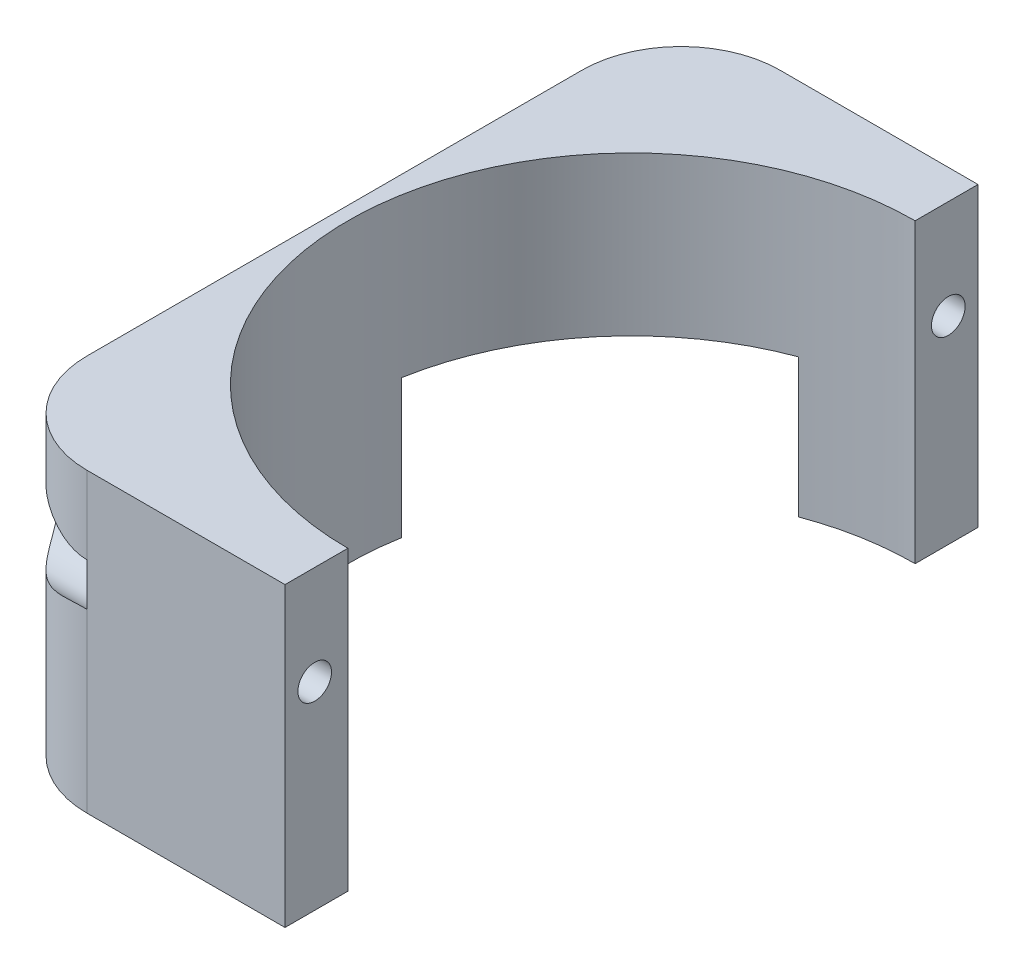
from build123d import *

# Parameters (mm, degrees)
SKETCH_1_W          = 60
SKETCH_1_H          = 70
SKETCH_1_R          = 28.65
EXTRUDE_1_DEPTH     = 30
SKETCH_2_W          = 76.072381137
SKETCH_2_H          = 88.67236145
CUT_EXTRUDE_1_DEPTH = 30
SKETCH_3_R          = 1.7
CUT_EXTRUDE_2_DEPTH = 40
SKETCH_4_W          = 20
SKETCH_4_H          = 14
CUT_EXTRUDE_3_DEPTH = 30
SKETCH_5_R          = 3.7
CUT_EXTRUDE_4_DEPTH = 10
FILLET_1_DEPTH      = 30


with BuildPart() as part:
    # 草图1 → 凸台-拉伸1 (new body)
    with BuildSketch(Plane(origin=(0, 0, 0), x_dir=(1, 0, 0), z_dir=(0, 1, 0))):
        Rectangle(SKETCH_1_W, SKETCH_1_H)
        with Locations(Location((0, 0, 0), (0, 0, 270))):
            Circle(SKETCH_1_R, mode=Mode.SUBTRACT)
    extrude(amount=EXTRUDE_1_DEPTH)

    # 草图2 → 切除-拉伸1 (cut)
    with BuildSketch(Plane(origin=(0, 30, 0), x_dir=(1, 0, 0), z_dir=(0, 1, 0))):
        with Locations((38.036190569, 1.889997047)):
            Rectangle(SKETCH_2_W, SKETCH_2_H)
    extrude(amount=-CUT_EXTRUDE_1_DEPTH, mode=Mode.SUBTRACT)

    # 草图3 → 切除-拉伸2 (cut)
    with BuildSketch(Plane(origin=(0, 0, 0), x_dir=(0, 0, -1), z_dir=(1, 0, 0))):
        with Locations((32, 20)):
            Circle(SKETCH_3_R)
        with Locations((-32, 20)):
            Circle(SKETCH_3_R)
    extrude(amount=-CUT_EXTRUDE_2_DEPTH, mode=Mode.SUBTRACT)

    # 草图4 → 切除-拉伸3 (cut)
    with BuildSketch(Plane(origin=(0, 0, -35), x_dir=(-1, 0, 0), z_dir=(0, 0, -1))):
        with Locations((20, 7)):
            Rectangle(SKETCH_4_W, SKETCH_4_H)
    extrude(amount=-CUT_EXTRUDE_3_DEPTH, mode=Mode.SUBTRACT)

    # 草图5 → 切除-拉伸4 (cut)
    with BuildSketch(Plane.ZY.offset(30)):
        with Locations((-32, 20)):
            Circle(SKETCH_5_R)
        with Locations((32, 20)):
            Circle(SKETCH_5_R)
    extrude(amount=-CUT_EXTRUDE_4_DEPTH, mode=Mode.SUBTRACT)

    # 圆角1: read off the stored shape, not the designer's step
    # 圆角1 outline → 圆角1 (cut)
    with BuildSketch(Plane(origin=(0, 0, 0), x_dir=(1, 0, 0), z_dir=(0, 1, 0))):
        with BuildLine():
            Line((-30, -35), (-20, -35))
            ThreePointArc((-20, -35), (-27.071067812, -32.071067812), (-30, -25))
            Line((-30, -25), (-30, -35))
        make_face()
        with BuildLine():
            Line((-30, 35), (-30, 25))
            ThreePointArc((-30, 25), (-27.071067812, 32.071067812), (-20, 35))
            Line((-20, 35), (-30, 35))
        make_face()
    extrude(amount=FILLET_1_DEPTH, mode=Mode.SUBTRACT)


solid = part.part
